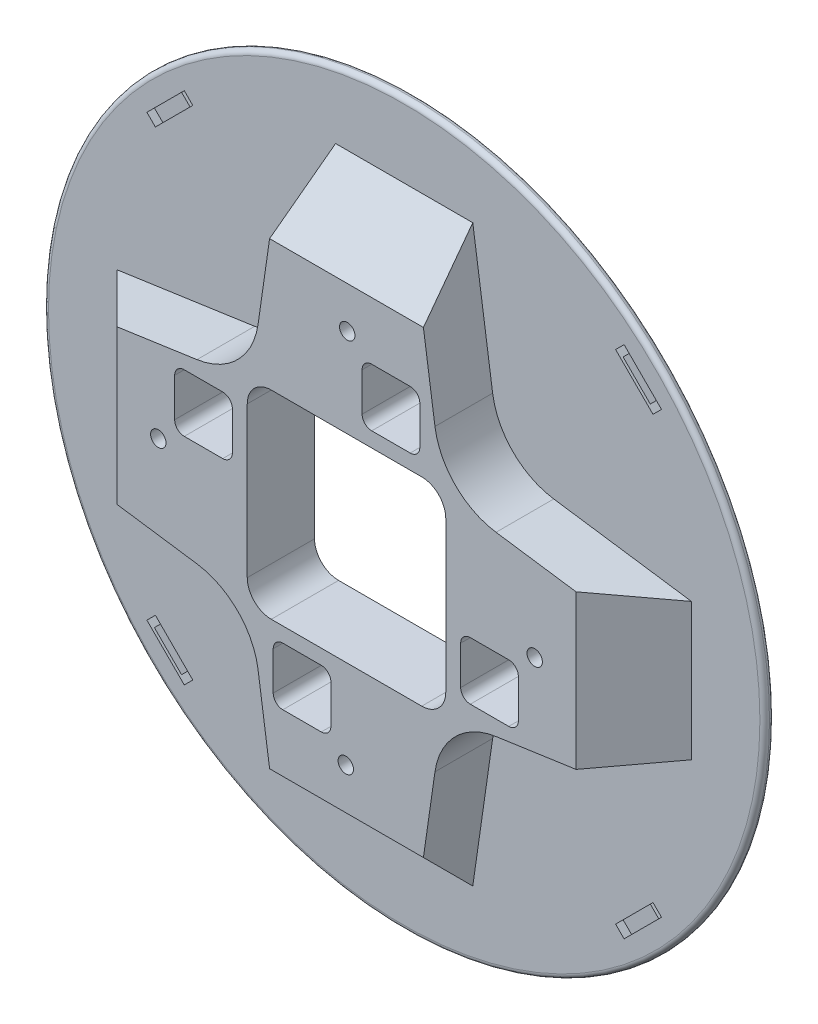
from build123d import *

# Parameters (mm, degrees)
SKETCH_1_W          = 95.5
SKETCH_1_H          = 95.5
EXTRUDE_1_DEPTH     = 12
CUT_EXTRUDE_1_DEPTH = 69.58662406
FILLET_2_R          = 15
SKETCH_3_R          = 75
EXTRUDE_2_DEPTH     = 2
CHAMFER_1_SIZE      = 12
FILLET_1_R          = 1
SKETCH_6_W          = 42
SKETCH_6_H          = 42
CUT_EXTRUDE_3_DEPTH = 107.98598046
SKETCH_7_R          = 1.6
CUT_EXTRUDE_4_DEPTH = 107.98598046
CUT_EXTRUDE_5_DEPTH = 107.98598046
CUT_EXTRUDE_6_DEPTH = 0.5
SKETCH_10_W         = 12
SKETCH_10_H         = 12
CUT_EXTRUDE_7_DEPTH = 107.98598046
SKETCH_11_W         = 42
SKETCH_11_H         = 42
EXTRUDE_3_DEPTH     = 14
FILLET_3_R          = 2
SKETCH_12_W         = 41.3
SKETCH_12_H         = 41.3
CUT_EXTRUDE_8_DEPTH = 107.98598046
FILLET_4_R          = 5
SKETCH_13_R         = 3.25
CUT_EXTRUDE_9_DEPTH = 3


with BuildPart() as part:
    # ｽｹｯﾁ1 → ﾎﾞｽ - 押し出し1 (new body)
    with BuildSketch(Plane.XY):
        Rectangle(SKETCH_1_W, SKETCH_1_H)
    extrude(amount=EXTRUDE_1_DEPTH)

    # ｽｹｯﾁ2 → ｶｯﾄ - 押し出し1 (cut, through all)
    with BuildSketch(Plane.XY.offset(12)):
        Polygon((-16, 47.75), (-20, 20), (-47.75, 16), (-47.75, 47.75), align=None)
        Polygon((-16, -47.75), (-20, -20), (-47.75, -16), (-47.75, -47.75), align=None)
    cut_extrude_1 = extrude(amount=-CUT_EXTRUDE_1_DEPTH, mode=Mode.SUBTRACT)

    # ﾐﾗｰ1: ｶｯﾄ - 押し出し1 across plane
    add(cut_extrude_1.mirror(Plane(origin=(0, 0, 0), x_dir=(0, 0, 1), z_dir=(1, 0, 0))), mode=Mode.SUBTRACT)

    # ﾌｨﾚｯﾄ2
    fillet_2_edges = [part.edges().sort_by_distance(p)[0] for p in [
        (-20, 20, 6),
        (-20, -20, 6),
        (20, 20, 6),
        (20, -20, 6),
    ]]
    fillet(fillet_2_edges, radius=FILLET_2_R)

    # ｽｹｯﾁ3 → ﾎﾞｽ - 押し出し2 (add)
    with BuildSketch(Plane(origin=(0, 0, 0), x_dir=(-1, 0, 0), z_dir=(0, 0, -1))):
        Circle(SKETCH_3_R)
    extrude(amount=EXTRUDE_2_DEPTH)

    # 面取り1
    chamfer_1_edges = [part.edges().sort_by_distance(p)[0] for p in [
        (0, 47.75, 0),
        (47.75, 0, 0),
        (0, -47.75, 0),
        (-47.75, 0, 0),
    ]]
    chamfer(chamfer_1_edges, length=CHAMFER_1_SIZE - 0.0001)  # a hair under: the kernel refuses the full size

    # ﾌｨﾚｯﾄ1
    fillet_1_edges = [part.edges().sort_by_distance(p)[0] for p in [
        (75, 0, 0),
        (75, 0, -2),
    ]]
    fillet(fillet_1_edges, radius=FILLET_1_R - 0.0001)  # a hair under: the kernel refuses the full size

    # ｽｹｯﾁ6 → ｶｯﾄ - 押し出し3 (cut, through all)
    with BuildSketch(Plane.XY.offset(12)):
        Rectangle(SKETCH_6_W, SKETCH_6_H)
    extrude(amount=-CUT_EXTRUDE_3_DEPTH, mode=Mode.SUBTRACT)

    # ｽｹｯﾁ7 → ｶｯﾄ - 押し出し4 (cut, through all)
    with BuildSketch(Plane.XY.offset(12)):
        with Locations((0.15, 39.15)):
            Circle(SKETCH_7_R)
        with Locations((-39.15, 0.15)):
            Circle(SKETCH_7_R)
        with Locations((39.15, -0.15)):
            Circle(SKETCH_7_R)
        with Locations((-0.15, -39.15)):
            Circle(SKETCH_7_R)
    extrude(amount=-CUT_EXTRUDE_4_DEPTH, mode=Mode.SUBTRACT)

    # ｽｹｯﾁ8 → ｶｯﾄ - 押し出し5 (cut, through all)
    with BuildSketch(Plane(origin=(0, 0, -2), x_dir=(-1, 0, 0), z_dir=(0, 0, -1))):
        Polygon((-45.748737342, 53.526911935), (-46.809397513, 52.466251763), (-45.04163056, 50.69848481), (-43.980970389, 51.759144982), align=None)
        Polygon((-53.526911935, 45.748737342), (-51.759144982, 43.980970389), (-50.69848481, 45.04163056), (-52.466251763, 46.809397513), align=None)
        Polygon((43.980970389, 51.759144982), (45.04163056, 50.69848481), (46.809397513, 52.466251763), (45.748737342, 53.526911935), align=None)
        Polygon((51.759144982, 43.980970389), (53.526911935, 45.748737342), (52.466251763, 46.809397513), (50.69848481, 45.04163056), align=None)
    cut_extrude_5 = extrude(amount=-CUT_EXTRUDE_5_DEPTH, mode=Mode.SUBTRACT)

    # ｽｹｯﾁ9 → ｶｯﾄ - 押し出し6 (cut)
    with BuildSketch(Plane.XY):
        Polygon((-53.526911935, 45.748737342), (-45.748737342, 53.526911935), (-43.980970389, 51.759144982), (-51.759144982, 43.980970389), align=None)
        Polygon((43.980970389, 51.759144982), (51.759144982, 43.980970389), (53.526911935, 45.748737342), (45.748737342, 53.526911935), align=None)
    cut_extrude_6 = extrude(amount=-CUT_EXTRUDE_6_DEPTH, mode=Mode.SUBTRACT)

    # ﾐﾗｰ2: ｶｯﾄ - 押し出し5, ｶｯﾄ - 押し出し6 across plane
    add(cut_extrude_5.mirror(Plane.ZX), mode=Mode.SUBTRACT)
    add(cut_extrude_6.mirror(Plane.ZX), mode=Mode.SUBTRACT)

    # ｽｹｯﾁ10 → ｶｯﾄ - 押し出し7 (cut, through all)
    with BuildSketch(Plane.XY.offset(12)):
        with Locations((-29.75, 9.25)):
            Rectangle(SKETCH_10_W, SKETCH_10_H)
        with Locations((-9.25, -29.75)):
            Rectangle(SKETCH_10_W, SKETCH_10_H)
        with Locations((29.75, -9.25)):
            Rectangle(SKETCH_10_W, SKETCH_10_H)
        with Locations((9.25, 29.75)):
            Rectangle(SKETCH_10_W, SKETCH_10_H)
    extrude(amount=-CUT_EXTRUDE_7_DEPTH, mode=Mode.SUBTRACT)

    # ｽｹｯﾁ11 → ﾎﾞｽ - 押し出し3 (add, through all)
    with BuildSketch(Plane(origin=(0, 0, -2), x_dir=(-1, 0, 0), z_dir=(0, 0, -1))):
        Rectangle(SKETCH_11_W, SKETCH_11_H)
    extrude(amount=-EXTRUDE_3_DEPTH)

    # ﾌｨﾚｯﾄ3
    fillet_3_edges = [part.edges().sort_by_distance(p)[0] for p in [
        (-35.75, 3.25, 5),
        (-35.75, 15.25, 5),
        (-23.75, 15.25, 5),
        (-23.75, 3.25, 5),
        (-15.25, -35.75, 5),
        (-15.25, -23.75, 5),
        (-3.25, -23.75, 5),
        (-3.25, -35.75, 5),
        (35.75, -3.25, 5),
        (35.75, -15.25, 5),
        (23.75, -15.25, 5),
        (23.75, -3.25, 5),
        (15.25, 35.75, 5),
        (15.25, 23.75, 5),
        (3.25, 23.75, 5),
        (3.25, 35.75, 5),
    ]]
    fillet(fillet_3_edges, radius=FILLET_3_R)

    # ｽｹｯﾁ12 → ｶｯﾄ - 押し出し8 (cut, through all)
    with BuildSketch(Plane.XY.offset(12)):
        Rectangle(SKETCH_12_W, SKETCH_12_H)
    extrude(amount=-CUT_EXTRUDE_8_DEPTH, mode=Mode.SUBTRACT)

    # ﾌｨﾚｯﾄ4
    fillet_4_edges = [part.edges().sort_by_distance(p)[0] for p in [
        (-20.65, -20.65, 5),
        (-20.65, 20.65, 5),
        (20.65, 20.65, 5),
        (20.65, -20.65, 5),
    ]]
    fillet(fillet_4_edges, radius=FILLET_4_R)

    # ｽｹｯﾁ13 → ｶｯﾄ - 押し出し9 (cut)
    with BuildSketch(Plane(origin=(0, 0, -2), x_dir=(-1, 0, 0), z_dir=(0, 0, -1))):
        with Locations((-0.15, 39.15)):
            Circle(SKETCH_13_R)
        with Locations((39.15, 0.15)):
            Circle(SKETCH_13_R)
        with Locations((-39.15, -0.15)):
            Circle(SKETCH_13_R)
        with Locations((0.15, -39.15)):
            Circle(SKETCH_13_R)
    extrude(amount=-CUT_EXTRUDE_9_DEPTH, mode=Mode.SUBTRACT)


solid = part.part
